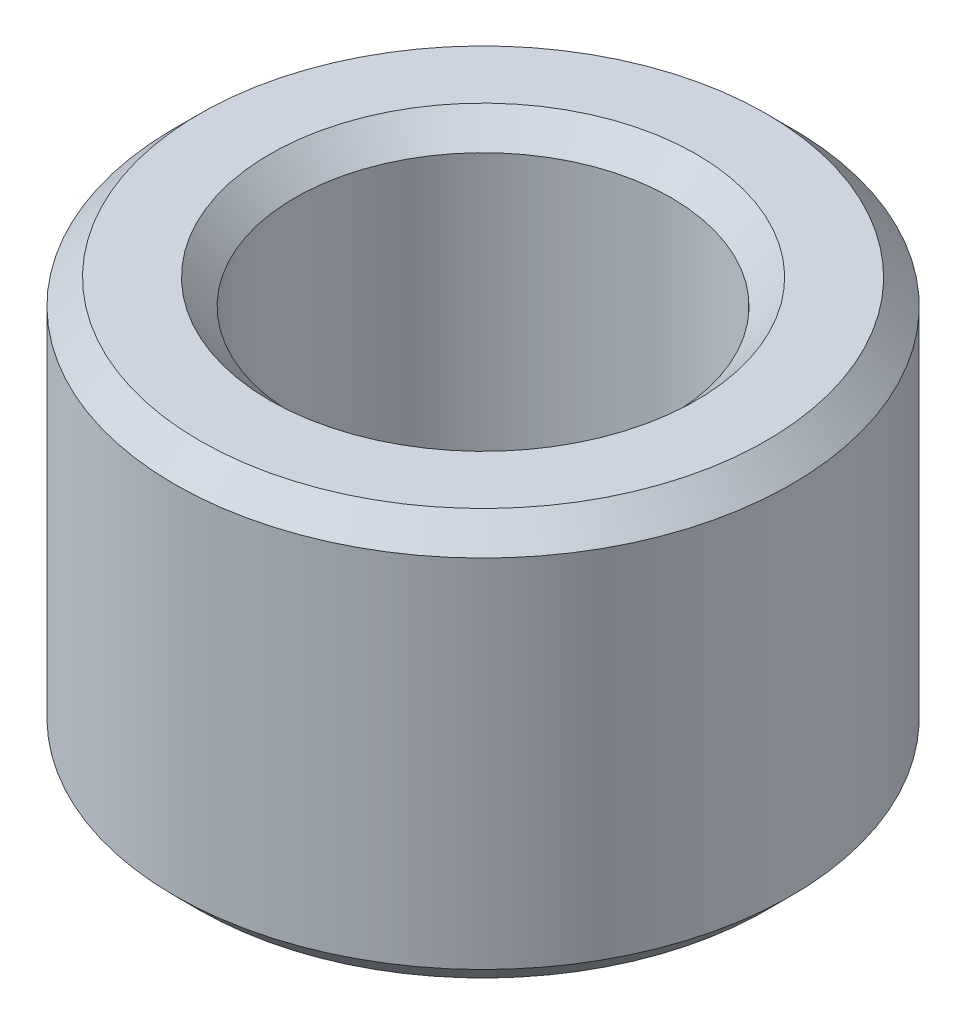
from build123d import *

# Parameters (mm, degrees)
SKETCH1_R           = 47.5
BOSS_EXTRUDE1_DEPTH = 62.626797835
SKETCH2_R           = 28.970334503
CUT_EXTRUDE1_DEPTH  = 92.840164455
CHAMFER1_SIZE       = 3.874630704


with BuildPart() as part:
    # Sketch1 → Boss-Extrude1 (new body)
    with BuildSketch(Plane(origin=(0, 0, 0), x_dir=(1, 0, 0), z_dir=(0, 1, 0))):
        Circle(SKETCH1_R)
    extrude(amount=BOSS_EXTRUDE1_DEPTH)

    # Sketch2 → Cut-Extrude1 (cut, through all)
    with BuildSketch(Plane(origin=(0, 0, 0), x_dir=(1, 0, 0), z_dir=(0, 1, 0))):
        Circle(SKETCH2_R)
    extrude(amount=CUT_EXTRUDE1_DEPTH, mode=Mode.SUBTRACT)

    # Chamfer1
    chamfer1_edges = [part.edges().sort_by_distance(p)[0] for p in [
        (-28.970334503, 62.626797835, 0),
        (-28.970334503, 0, 0),
        (-47.5, 0, 0),
        (-47.5, 62.626797835, 0),
    ]]
    chamfer(chamfer1_edges, length=CHAMFER1_SIZE)


solid = part.part
